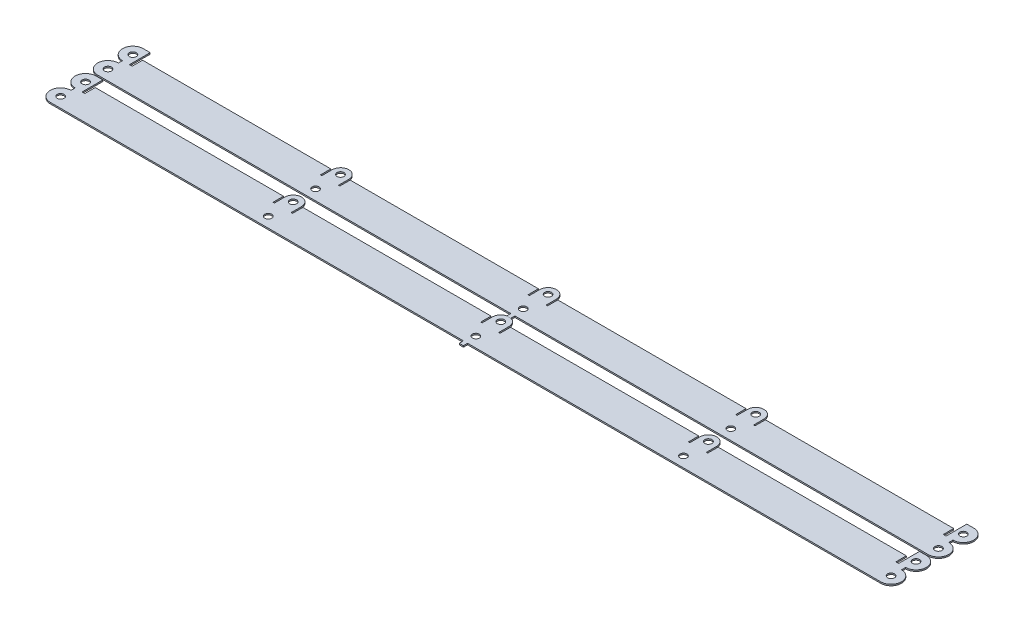
from build123d import *

# Parameters (mm, degrees)
SKETCH1_R           = 2.5
BOSS_EXTRUDE1_DEPTH = 1
LPATTERN1_COUNT     = 2
LPATTERN1_PITCH     = 34.2


with BuildPart() as part:
    # Sketch1 → Boss-Extrude1 (new body)
    with BuildSketch(Plane(origin=(0, 0, 0), x_dir=(1, 0, 0), z_dir=(0, 1, 0))):
        with BuildLine():
            ThreePointArc((-300, 7.5), (-307.5, 0), (-300, -7.5))
            Line((-300, -7.5), (-1.5, -7.5))
            Line((-1.5, -7.5), (-1.5, -10.5))
            Line((-1.5, -10.5), (1.5, -10.5))
            Line((1.5, -10.5), (1.5, -7.5))
            Line((1.5, -7.5), (300, -7.5))
            ThreePointArc((300, -7.5), (307.5, 0), (300, 7.5))
            Line((300, 7.5), (300, 10.5))
            ThreePointArc((300, 10.5), (307.5, 18), (300, 25.5))
            Line((300, 25.5), (295, 25.5))
            Line((295, 25.5), (295, 10.5))
            Line((295, 10.5), (293, 10.5))
            Line((293, 10.5), (293, 18))
            Line((293, 18), (157, 18))
            Line((157, 18), (157, 10.5))
            Line((157, 10.5), (156, 10.5))
            Line((156, 10.5), (156, 18))
            ThreePointArc((156, 18), (150, 24), (144, 18))
            Line((144, 18), (144, 10.5))
            Line((144, 10.5), (143, 10.5))
            Line((143, 10.5), (143, 18))
            Line((143, 18), (7, 18))
            Line((7, 18), (7, 10.5))
            Line((7, 10.5), (6, 10.5))
            Line((6, 10.5), (6, 18))
            ThreePointArc((6, 18), (0, 24), (-6, 18))
            Line((-6, 18), (-6, 10.5))
            Line((-6, 10.5), (-7, 10.5))
            Line((-7, 10.5), (-7, 18))
            Line((-7, 18), (-143, 18))
            Line((-143, 18), (-143, 10.5))
            Line((-143, 10.5), (-144, 10.5))
            Line((-144, 10.5), (-144, 18))
            ThreePointArc((-144, 18), (-150, 24), (-156, 18))
            Line((-156, 18), (-156, 10.5))
            Line((-156, 10.5), (-157, 10.5))
            Line((-157, 10.5), (-157, 18))
            Line((-157, 18), (-293, 18))
            Line((-293, 18), (-293, 10.5))
            Line((-293, 10.5), (-295, 10.5))
            Line((-295, 10.5), (-295, 25.5))
            Line((-295, 25.5), (-300, 25.5))
            ThreePointArc((-300, 25.5), (-307.5, 18), (-300, 10.5))
            Line((-300, 10.5), (-300, 7.5))
        make_face()
        with Locations((-300, 0)):
            Circle(SKETCH1_R, mode=Mode.SUBTRACT)
        with Locations((-150, 0)):
            Circle(SKETCH1_R, mode=Mode.SUBTRACT)
        Circle(SKETCH1_R, mode=Mode.SUBTRACT)
        with Locations((150, 0)):
            Circle(SKETCH1_R, mode=Mode.SUBTRACT)
        with Locations((300, 0)):
            Circle(SKETCH1_R, mode=Mode.SUBTRACT)
        with Locations((-300, 18)):
            Circle(SKETCH1_R, mode=Mode.SUBTRACT)
        with Locations((-150, 18)):
            Circle(SKETCH1_R, mode=Mode.SUBTRACT)
        with Locations((0, 18)):
            Circle(SKETCH1_R, mode=Mode.SUBTRACT)
        with Locations((150, 18)):
            Circle(SKETCH1_R, mode=Mode.SUBTRACT)
        with Locations((300, 18)):
            Circle(SKETCH1_R, mode=Mode.SUBTRACT)
    extrude(amount=BOSS_EXTRUDE1_DEPTH)


with BuildPart() as lpattern1_1:
    # LPattern1: pattern copy
    add(part.part.moved(Location(Vector(0, 0, -1) * (1 * LPATTERN1_PITCH))))


solid = Compound([part.part, lpattern1_1.part])
